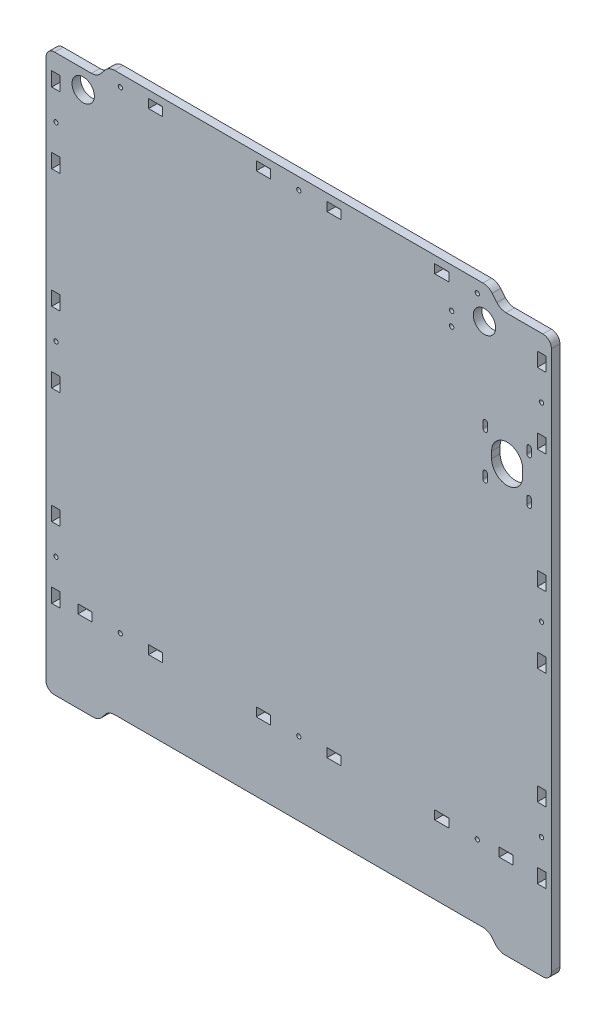
from build123d import *

# Parameters (mm, degrees)
SKETCH_1_R      = 1.55
SKETCH_1_R_2    = 7.9
SKETCH_1_R_3    = 1.500000002
SKETCH_1_R_4    = 1.500000001
SKETCH_1_R_5    = 1.5
SKETCH_1_W      = 6
SKETCH_1_H      = 10
SKETCH_1_W_2    = 9.994814166
SKETCH_1_H_2    = 6.199822499
SKETCH_1_W_3    = 9.849167249
SKETCH_1_W_4    = 9.971716679
SKETCH_1_H_3    = 6.19978722
SKETCH_1_W_5    = 9.976438663
SKETCH_1_W_6    = 9.849167498
SKETCH_1_W_7    = 9.949996322
SKETCH_1_W_8    = 9.96963529
SKETCH_1_H_4    = 6.199787221
SKETCH_1_W_9    = 9.974357274
SKETCH_1_W_10   = 9.973103266
EXTRUDE_1_DEPTH = 6


with BuildPart() as part:
    # Эскиз1 → Бобышка-Вытянуть1 (new body)
    with BuildSketch(Plane.XY):
        with BuildLine():
            Line((146.78294751, 193.302051095), (172.819332416, 193.302051095))
            ThreePointArc((172.819332416, 193.302051095), (177.057845498, 191.548593198), (178.819099243, 187.313313634))
            Line((178.819099243, 187.313313634), (178.819099243, -193.997737318))
            ThreePointArc((178.819099243, -193.997737318), (177.061822371, -198.240295567), (172.819332417, -199.997737318))
            Line((172.819332417, -199.997737318), (145.782947511, -199.997737318))
            ThreePointArc((145.782947511, -199.997737318), (142.190692287, -199.201353507), (139.271569745, -196.961432))
            Line((139.271569745, -196.961432), (136.975743692, -193.941778905))
            ThreePointArc((136.975743692, -193.941778905), (134.05662115, -191.701857397), (130.464365925, -190.905473587))
            Line((130.464365925, -190.905473587), (-129.825701091, -190.905473587))
            ThreePointArc((-129.825701091, -190.905473587), (-133.417956316, -191.701857397), (-136.337078858, -193.941778905))
            Line((-136.337078858, -193.941778905), (-138.632904911, -196.961432))
            ThreePointArc((-138.632904911, -196.961432), (-141.552027452, -199.201353507), (-145.144282677, -199.997737318))
            Line((-145.144282677, -199.997737318), (-172.180667583, -199.997737318))
            ThreePointArc((-172.180667583, -199.997737318), (-175.936297818, -198.854153558), (-178.180900757, -195.633237551))
            Line((-178.180900757, -195.633237551), (-178.180900757, 187.302262682))
            ThreePointArc((-178.180900757, 187.302262682), (-176.423541444, 191.54490337), (-172.180900757, 193.302262682))
            Line((-172.180900757, 193.302262682), (-146.144282678, 193.302262682))
            ThreePointArc((-146.144282678, 193.302262682), (-142.552027454, 194.098646493), (-139.632904912, 196.338568))
            Line((-139.632904912, 196.338568), (-136.337078859, 200.265957365))
            ThreePointArc((-136.337078859, 200.265957365), (-133.417956317, 202.505878872), (-129.825701092, 203.302262682))
            Line((-129.825701092, 203.302262682), (130.464365924, 203.302262682))
            ThreePointArc((130.464365924, 203.302262682), (134.056621149, 202.505878872), (136.975743691, 200.265957365))
            Line((136.975743691, 200.265957365), (140.271619094, 196.338462243))
            ThreePointArc((140.271619094, 196.338462243), (143.19070523, 194.098493291), (146.78294751, 193.302051095))
        make_face()
        with Locations((108.319099243, 165.602262682)):
            Circle(SKETCH_1_R, mode=Mode.SUBTRACT)
        with Locations((108.319099243, 175.302262682)):
            Circle(SKETCH_1_R, mode=Mode.SUBTRACT)
        with Locations((131.519099243, 180.302262682)):
            Circle(SKETCH_1_R_2, mode=Mode.SUBTRACT)
        with Locations((-151.980900757, 180.302262682)):
            Circle(SKETCH_1_R_2, mode=Mode.SUBTRACT)
        with Locations((-171.180900757, 150.902262682)):
            Circle(SKETCH_1_R_3, mode=Mode.SUBTRACT)
        with Locations((-171.180900757, 16.742262682)):
            Circle(SKETCH_1_R_4, mode=Mode.SUBTRACT)
        with Locations((171.819099243, 150.902051095)):
            Circle(SKETCH_1_R_4, mode=Mode.SUBTRACT)
        with Locations((126.462093852, 195.057081698)):
            Circle(SKETCH_1_R_5, mode=Mode.SUBTRACT)
        with Locations((-125.710663701, 195.057081698)):
            Circle(SKETCH_1_R_5, mode=Mode.SUBTRACT)
        with Locations((0.358090643, 195.057081698)):
            Circle(SKETCH_1_R_5, mode=Mode.SUBTRACT)
        with Locations((-125.74954067, -139.065910363)):
            Circle(SKETCH_1_R_5, mode=Mode.SUBTRACT)
        with Locations((-171.180900757, -114.967737318)):
            Circle(SKETCH_1_R_5, mode=Mode.SUBTRACT)
        with Locations((0.375695716, -139.065910363)):
            Circle(SKETCH_1_R_5, mode=Mode.SUBTRACT)
        with Locations((126.442808867, -139.065910363)):
            Circle(SKETCH_1_R_5, mode=Mode.SUBTRACT)
        with Locations((171.819099243, -114.967948905)):
            Circle(SKETCH_1_R_5, mode=Mode.SUBTRACT)
        with Locations((171.819099244, 16.742051095)):
            Circle(SKETCH_1_R_5, mode=Mode.SUBTRACT)
        with BuildLine():
            Line((133.65547985, 83.46981119), (133.65547985, 87.96981119))
            ThreePointArc((133.65547985, 87.96981119), (132.05547985, 89.56981119), (130.45547985, 87.96981119))
            Line((130.45547985, 87.96981119), (130.45547985, 83.46981119))
            ThreePointArc((130.45547985, 83.46981119), (132.05547985, 81.86981119), (133.65547985, 83.46981119))
        make_face(mode=Mode.SUBTRACT)
        with BuildLine():
            Line((133.65547985, 118.96981119), (133.65547985, 114.46981119))
            ThreePointArc((133.65547985, 114.46981119), (132.05547985, 112.86981119), (130.45547985, 114.46981119))
            Line((130.45547985, 114.46981119), (130.45547985, 118.96981119))
            ThreePointArc((130.45547985, 118.96981119), (132.05547985, 120.56981119), (133.65547985, 118.96981119))
        make_face(mode=Mode.SUBTRACT)
        with BuildLine():
            Line((158.55547985, 98.96981119), (158.55547985, 103.46981119))
            ThreePointArc((158.55547985, 103.46981119), (147.55547985, 114.46981119), (136.55547985, 103.46981119))
            Line((136.55547985, 103.46981119), (136.55547985, 98.96981119))
            ThreePointArc((136.55547985, 98.96981119), (147.55547985, 87.96981119), (158.55547985, 98.96981119))
        make_face(mode=Mode.SUBTRACT)
        with BuildLine():
            Line((161.45547985, 118.96981119), (161.45547985, 114.46981119))
            ThreePointArc((161.45547985, 114.46981119), (163.05547985, 112.86981119), (164.65547985, 114.46981119))
            Line((164.65547985, 114.46981119), (164.65547985, 118.96981119))
            ThreePointArc((164.65547985, 118.96981119), (163.05547985, 120.56981119), (161.45547985, 118.96981119))
        make_face(mode=Mode.SUBTRACT)
        with BuildLine():
            Line((161.45547985, 83.46981119), (161.45547985, 87.96981119))
            ThreePointArc((161.45547985, 87.96981119), (163.05547985, 89.56981119), (164.65547985, 87.96981119))
            Line((164.65547985, 87.96981119), (164.65547985, 83.46981119))
            ThreePointArc((164.65547985, 83.46981119), (163.05547985, 81.86981119), (161.45547985, 83.46981119))
        make_face(mode=Mode.SUBTRACT)
        with Locations((-171.180900756, 41.742262682)):
            Rectangle(SKETCH_1_W, SKETCH_1_H, mode=Mode.SUBTRACT)
        with Locations((101.375242683, -139.100475893)):
            Rectangle(SKETCH_1_W_2, SKETCH_1_H_2, mode=Mode.SUBTRACT)
        with Locations((146.834619429, -139.100475893)):
            Rectangle(SKETCH_1_W_3, SKETCH_1_H_2, mode=Mode.SUBTRACT)
        with Locations((-24.705755079, 195.005248414)):
            Rectangle(SKETCH_1_W_4, SKETCH_1_H_3, mode=Mode.SUBTRACT)
        with Locations((25.291923766, 195.005248414)):
            Rectangle(SKETCH_1_W_5, SKETCH_1_H_3, mode=Mode.SUBTRACT)
        with Locations((-150.741012535, -139.100475893)):
            Rectangle(SKETCH_1_W_6, SKETCH_1_H_2, mode=Mode.SUBTRACT)
        with Locations((-100.791387959, -139.100475893)):
            Rectangle(SKETCH_1_W_7, SKETCH_1_H_2, mode=Mode.SUBTRACT)
        with Locations((-24.706795773, -139.09908242)):
            Rectangle(SKETCH_1_W_8, SKETCH_1_H_4, mode=Mode.SUBTRACT)
        with Locations((25.290883071, -139.09908242)):
            Rectangle(SKETCH_1_W_9, SKETCH_1_H_4, mode=Mode.SUBTRACT)
        with Locations((-171.180900757, -8.257737318)):
            Rectangle(SKETCH_1_W, SKETCH_1_H, mode=Mode.SUBTRACT)
        with Locations((-171.180900757, 175.902262682)):
            Rectangle(SKETCH_1_W, SKETCH_1_H, mode=Mode.SUBTRACT)
        with Locations((-171.180900757, 125.902262682)):
            Rectangle(SKETCH_1_W, SKETCH_1_H, mode=Mode.SUBTRACT)
        with Locations((-171.180900756, -89.987737318)):
            Rectangle(SKETCH_1_W, SKETCH_1_H, mode=Mode.SUBTRACT)
        with Locations((-171.180900757, -139.977737318)):
            Rectangle(SKETCH_1_W, SKETCH_1_H, mode=Mode.SUBTRACT)
        with Locations((171.819099243, 41.742051095)):
            Rectangle(SKETCH_1_W, SKETCH_1_H, mode=Mode.SUBTRACT)
        with Locations((171.819099243, -8.257948905)):
            Rectangle(SKETCH_1_W, SKETCH_1_H, mode=Mode.SUBTRACT)
        with Locations((171.819099244, -89.987948905)):
            Rectangle(SKETCH_1_W, SKETCH_1_H, mode=Mode.SUBTRACT)
        with Locations((171.819099243, -139.977948905)):
            Rectangle(SKETCH_1_W, SKETCH_1_H, mode=Mode.SUBTRACT)
        Polygon((168.819099243, 170.902051095), (168.819099243, 180.902051095), (174.819099243, 180.902051095), (174.819099243, 170.978103712), (175.199691798, 170.902051095), align=None, mode=Mode.SUBTRACT)
        with Locations((171.819099243, 125.902051095)):
            Rectangle(SKETCH_1_W, SKETCH_1_H, mode=Mode.SUBTRACT)
        with Locations((-100.779834487, 195.002849525)):
            Rectangle(SKETCH_1_W_10, SKETCH_1_H_3, mode=Mode.SUBTRACT)
        Polygon((106.3778356, 191.902955915), (106.177011134, 191.91981119), (96.3778356, 191.902955915), (96.3778356, 198.102743135), (106.177011134, 198.11981119), (106.3778356, 198.102743135), align=None, mode=Mode.SUBTRACT)
    extrude(amount=EXTRUDE_1_DEPTH)


solid = part.part
